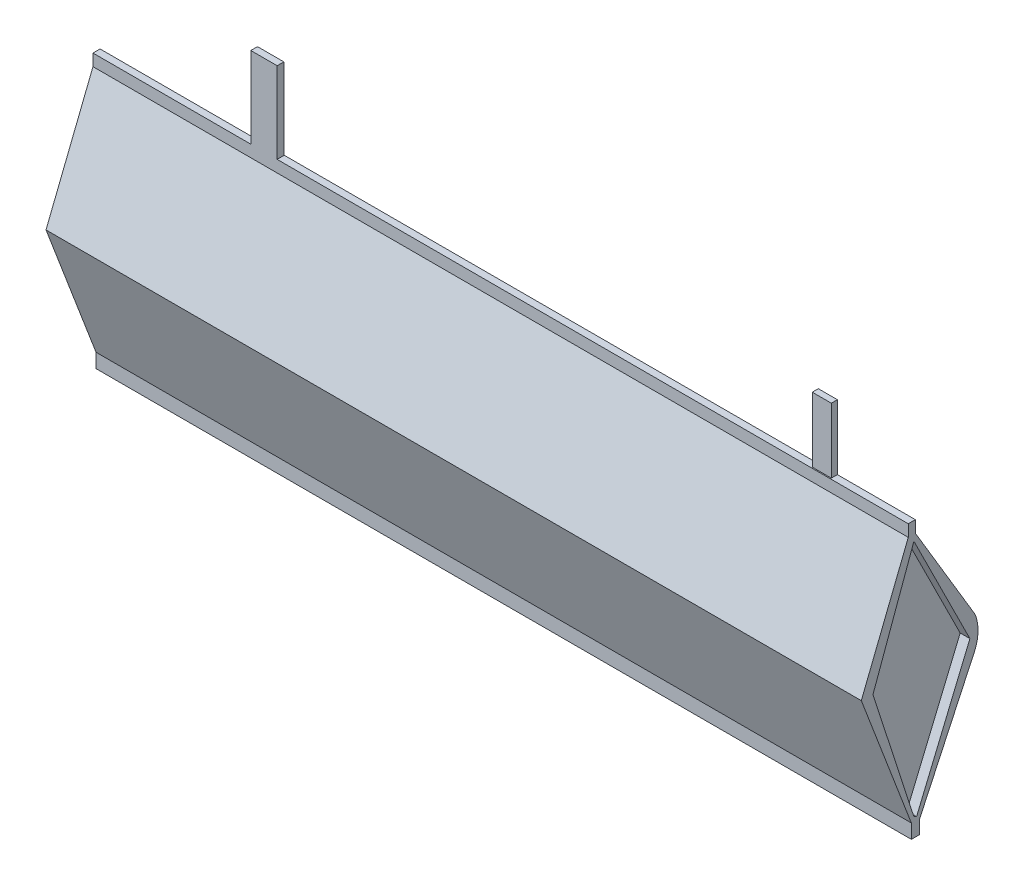
from build123d import *
from build123d.topology import SkipClean

# Parameters (mm, degrees)
SKETCH4_W           = 62.83623107
SKETCH4_H           = 84.722256574
BOSS_EXTRUDE2_DEPTH = 50
CUT_EXTRUDE2_DEPTH  = 80
CUT_EXTRUDE3_DEPTH  = 80
CUT_EXTRUDE5_DEPTH  = 80
CUT_EXTRUDE6_DEPTH  = 3
CUT_EXTRUDE8_DEPTH  = 80
CUT_EXTRUDE9_DEPTH  = 80
SKETCH11_W          = 5.870888161
SKETCH11_H          = 1.865764547
BOSS_EXTRUDE3_DEPTH = 20
SCALE1_SCALE        = 0.5
SCALE2_SCALE        = 0.4
SCALE3_SCALE        = 0.5
SCALE5_SCALE        = 4
BOSS_EXTRUDE5_DEPTH = 80
SKETCH15_W          = 3.250018584
SKETCH15_H          = 0.826724594
BOSS_EXTRUDE6_DEPTH = 10


with BuildPart() as part:
    # Sketch4 → Boss-Extrude2 (new body)
    with BuildSketch(Plane.XY):
        Rectangle(SKETCH4_W, SKETCH4_H)
    extrude(amount=BOSS_EXTRUDE2_DEPTH)

    # Sketch5 → Cut-Extrude2 (cut)
    with BuildSketch(Plane(origin=(31.418115535, 0, 0), x_dir=(0, 0, -1), z_dir=(1, 0, 0))):
        Polygon((-31.846034257, 38.728174008), (-31.846034257, 42.361128287), (-50, 42.361128287), (-50, -42.361128287), (-30.898434646, -42.361128287), (-30.898434646, -37.982426726), (-46.322270236, 2.38891709), align=None)
    extrude(amount=-CUT_EXTRUDE2_DEPTH, mode=Mode.SUBTRACT)

    # Sketch6 → Cut-Extrude3 (cut)
    with BuildSketch(Plane(origin=(31.418115535, 0, 0), x_dir=(0, 0, -1), z_dir=(1, 0, 0))):
        Polygon((-29.655383969, 42.361128287), (-29.655383969, 38.722554473), (-8.776416022, 3.750158878), (-28.328453067, -38.117745), (-28.328453067, -42.361128287), (-27.677514405, -46.625913761), (16.839811583, -52.045359618), (10.267667228, 27.190343951), (3.73953172, 54.484047391), align=None)
    extrude(amount=-CUT_EXTRUDE3_DEPTH, mode=Mode.SUBTRACT)

    # Sketch7 → Cut-Extrude5 (cut)
    with BuildSketch(Plane.ZY.offset(31.418115535)):
        with BuildLine():
            ThreePointArc((13.228873585, 11.208051798), (10.417703783, 4.563945687), (11.71087014, -2.533556863))
            ThreePointArc((11.71087014, -2.533556863), (0.747619784, 5.632177302), (13.228873585, 11.208051798))
        make_face()
    extrude(amount=-CUT_EXTRUDE5_DEPTH, mode=Mode.SUBTRACT)

    # Sketch8 → Cut-Extrude6 (cut)
    with BuildSketch(Plane(origin=(31.418115535, 0, 0), x_dir=(0, 0, -1), z_dir=(1, 0, 0))):
        Polygon((-30.111598921, 36.817435747), (-42.735074125, 2.19595341), (-30.111598921, -36.694083179), (-29.289064541, -37.07820135), (-12.845557678, 2.19595341), align=None)
    extrude(amount=-CUT_EXTRUDE6_DEPTH, mode=Mode.SUBTRACT)

    # Sketch9 → Cut-Extrude8 (cut)
    with BuildSketch(Plane(origin=(0, 0, 29.655383969), x_dir=(-1, 0, 0), z_dir=(0, 0, -1))):
        Polygon((19.869908303, 42.361128287), (19.869908303, 38.722554473), (19.869908303, 5.586987563), (19.869908303, -4.186945454), (19.869908303, -38.208459621), (19.869908303, -42.059759196), (19.869908303, -47.026854784), (41.256673117, -49.585938288), (42.081255469, -21.197702537), (42.081255469, 12.428184914), (37.482224788, 37.513066745), (31.418115535, 49.4837873), align=None)
    extrude(amount=-CUT_EXTRUDE8_DEPTH, mode=Mode.SUBTRACT)

    # Sketch10 → Cut-Extrude9 (cut)
    with BuildSketch(Plane(origin=(0, -2.877407212, 4.819674209), x_dir=(-1, 0, 0), z_dir=(0, 0.5126085745439567, -0.8586224136976701))):
        Polygon((19.869908303, 48.44965729), (25.693686727, -39.803296282), (32.448126733, -43.444815965), (49.802642339, -43.444815965), (32.448126733, 57.840856492), align=None)
    extrude(amount=-CUT_EXTRUDE9_DEPTH, mode=Mode.SUBTRACT)

    # Sketch11 → Boss-Extrude3 (add)
    with BuildSketch(Plane(origin=(0, 42.361128287, 0), x_dir=(1, 0, 0), z_dir=(0, 1, 0))):
        with Locations((4.437413085, -30.588266243)):
            Rectangle(SKETCH11_W, SKETCH11_H)
    extrude(amount=BOSS_EXTRUDE3_DEPTH)


with BuildPart() as part_1:
    # Scale1: scaled about (4.044501914, 0.935318094, 28.406526913)
    add(part.part.scale(SCALE1_SCALE).moved(Location((2.022250957, 0.467659047, 14.203263457))))


with BuildPart() as part_2:
    # Scale2: scaled about (4.044501914, 0.935318094, 28.406526913)
    add(part_1.part.scale(SCALE2_SCALE).moved(Location((2.426701148, 0.561190856, 17.043916148))))


with BuildPart() as part_3:
    # Scale3: scaled about (4.044501914, 0.935318094, 28.406526913)
    add(part_2.part.scale(SCALE3_SCALE).moved(Location((2.022250957, 0.467659047, 14.203263457))))


with BuildPart() as part_4:
    # Scale5: scaled about (4.044501914, 0.935318094, 28.406526913)
    add(part_3.part.scale(SCALE5_SCALE).moved(Location((-12.133505742, -2.805954282, -85.219580739))))


with BuildPart() as boss_extrude5_tool:
    # Sketch14 → Boss-Extrude5 (new body)
    with SkipClean():  # the faces are left unmerged after this step: merging them gives an invalid solid
        with BuildSketch(Plane.ZY.offset(5.521262115)):
            Polygon((28.906071344, 17.505641119), (29.782331459, 17.505641119), (29.782331459, 16.052459408), (35.572825851, 1.51675664), (29.403291615, -14.631780886), (29.403291615, -16.38326151), (28.087210799, -16.38326151), (28.1159044, -14.686132768), (21.408340925, -0.141125859), (21.121993698, 0.799090379), (21.024804823, 1.784179002), (21.121993698, 2.789147348), (21.41419066, 3.732235959), (28.906071344, 16.050211594), align=None)
        extrude(amount=BOSS_EXTRUDE5_DEPTH)


with BuildPart() as part_5:
    with SkipClean():  # the faces are left unmerged after this step: merging them gives an invalid solid
        add(part_4.part)


with BuildPart() as part_6:
    # Boss-Extrude5: joined with boss_extrude5_tool
    with SkipClean():  # the faces are left unmerged after this step: merging them gives an invalid solid
        add(part_5.part.fuse(boss_extrude5_tool.part, tol=0.00001))

    # Sketch15 → Boss-Extrude6 (add)
    with SkipClean():  # the faces are left unmerged after this step: merging them gives an invalid solid
        with BuildSketch(Plane(origin=(0, 17.505641119, 0), x_dir=(1, 0, 0), z_dir=(0, 1, 0))):
            with Locations((-64.439728037, -29.368969162)):
                Rectangle(SKETCH15_W, SKETCH15_H)
        extrude(amount=BOSS_EXTRUDE6_DEPTH)


solid = part_6.part
